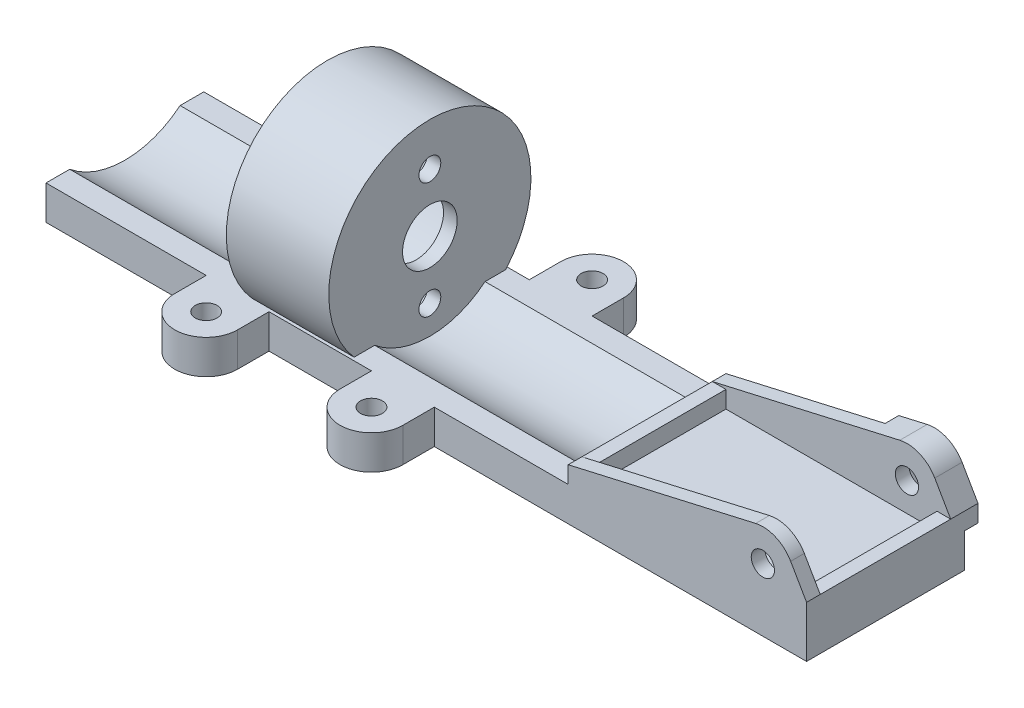
from build123d import *

# Parameters (mm, degrees)
SKETCH3_W                = 111.348371095
SKETCH3_H                = 23.1
BOSS_EXTRUDE1_DEPTH      = 5
SKETCH3_4_W              = 34.9
SKETCH3_4_H              = 23.1
BOSS_EXTRUDE2_DEPTH      = 2.5
CUT_EXTRUDE1_DEPTH       = 30.8
CUT_EXTRUDE1_DEPTH_BACK  = 67.894637304
SKETCH4_4_R              = 12.7
BOSS_EXTRUDE3_START      = -1
SKETCH4_R                = 12.7
SKETCH4_R_2              = 4
SKETCH4_R_3              = 1.6
BOSS_EXTRUDE3_DEPTH      = 2
BOSS_EXTRUDE4_DEPTH      = 2
BOSS_EXTRUDE4_DEPTH_BACK = 13
BOSS_EXTRUDE4_START      = -3
SKETCH4_3_R              = 14.8
SKETCH4_3_R_2            = 12.7
SKETCH5_R                = 4.6
SKETCH5_R_2              = 1.6
BOSS_EXTRUDE5_DEPTH      = 5
BOSS_EXTRUDE6_START      = 11.55
SKETCH6_R                = 1.7
BOSS_EXTRUDE6_DEPTH      = 2
BOSS_EXTRUDE7_START      = -11.55
BOSS_EXTRUDE7_OUTLINE_R  = 1.7
BOSS_EXTRUDE7_DEPTH      = 2
BOSS_EXTRUDE8_DEPTH      = 2
SHELL1_START             = -5
SHELL1_DEPTH             = 0.1
SHELL1_START_2           = -4.9
SHELL1_2_DEPTH           = 2.9
SHELL1_START_3           = -97.348371095
SHELL1_3_DEPTH           = 76.448371095
SHELL1_START_4           = -56.7
SHELL1_4_DEPTH           = 2
SHELL1_START_5           = -22.9
SHELL1_5_DEPTH           = 2


with BuildPart() as part:
    # Sketch3 → Boss-Extrude1 (new body)
    with BuildSketch(Plane(origin=(0, 0, 0), x_dir=(1, 0, 0), z_dir=(0, 1, 0))):
        with Locations((-43.674185548, 0)):
            Rectangle(SKETCH3_W, SKETCH3_H)
    extrude(amount=-BOSS_EXTRUDE1_DEPTH)

    # Sketch3<4> → Boss-Extrude2 (add)
    with BuildSketch(Plane(origin=(0, 0, 0), x_dir=(1, 0, 0), z_dir=(0, 1, 0))):
        with Locations((-5.45, 0)):
            Rectangle(SKETCH3_4_W, SKETCH3_4_H)
        Polygon((-20.2, 9.55), (9.3, 9.55), (10, 9.55), (10, -9.55), (9.3, -9.55), (-20.2, -9.55), (-20.9, -9.55), (-20.9, 9.55), align=None, mode=Mode.SUBTRACT)
    extrude(amount=BOSS_EXTRUDE2_DEPTH)

    # Sketch4<4> → Cut-Extrude1 (cut, two sides: drawn at the far end of the back side and taken through both)
    with BuildSketch(Plane(origin=(-53.7, 0, 0), x_dir=(0, 0, -1), z_dir=(1, 0, 0)).offset(-CUT_EXTRUDE1_DEPTH_BACK)):
        with Locations((0, 9.8)):
            Circle(SKETCH4_4_R)
    extrude(amount=CUT_EXTRUDE1_DEPTH + CUT_EXTRUDE1_DEPTH_BACK, mode=Mode.SUBTRACT)

    # Sketch4 → Boss-Extrude3 (add)
    with BuildSketch(Plane(origin=(-53.7, 0, 0), x_dir=(0, 0, -1), z_dir=(1, 0, 0)).offset(BOSS_EXTRUDE3_START)):
        with Locations((0, 9.8)):
            Circle(SKETCH4_R)
        with Locations((0, 9.8)):
            Circle(SKETCH4_R_2, mode=Mode.SUBTRACT)
        with Locations((0, 18.3)):
            Circle(SKETCH4_R_3, mode=Mode.SUBTRACT)
        with Locations((0, 1.3)):
            Circle(SKETCH4_R_3, mode=Mode.SUBTRACT)
    extrude(amount=-BOSS_EXTRUDE3_DEPTH)

    # Sketch4<3> → Boss-Extrude4 (add, two sides: drawn at the far end of the back side and taken through both)
    with BuildSketch(Plane(origin=(-53.7, 0, 0), x_dir=(0, 0, -1), z_dir=(1, 0, 0)).offset(BOSS_EXTRUDE4_START - BOSS_EXTRUDE4_DEPTH_BACK)):
        with Locations((0, 9.8)):
            Circle(SKETCH4_3_R)
        with Locations((0, 9.8)):
            Circle(SKETCH4_3_R_2, mode=Mode.SUBTRACT)
    extrude(amount=BOSS_EXTRUDE4_DEPTH + BOSS_EXTRUDE4_DEPTH_BACK)

    # Sketch5 → Boss-Extrude5 (add)
    # profile 1 of 6: a face of its own
    with BuildSketch(Plane(origin=(0, 0, 0), x_dir=(1, 0, 0), z_dir=(0, 1, 0))):
        with Locations((-47.098371095, -16.15)):
            Circle(SKETCH5_R)
        with Locations(Location((-47.098371095, -16.15, 0), (0, 0, 270))):
            Circle(SKETCH5_R_2, mode=Mode.SUBTRACT)
    # profile 2 of 6: a face of its own
    with BuildSketch(Plane(origin=(0, 0, 0), x_dir=(1, 0, 0), z_dir=(0, 1, 0))):
        with BuildLine():
            Line((-51.698371095, -11.55), (-51.698371095, -16.15))
            ThreePointArc((-51.698371095, -16.15), (-50.351062288, -12.897308807), (-47.098371095, -11.55))
            Line((-47.098371095, -11.55), (-51.698371095, -11.55))
        make_face()
    # profile 3 of 6: a face of its own
    with BuildSketch(Plane(origin=(0, 0, 0), x_dir=(1, 0, 0), z_dir=(0, 1, 0))):
        with BuildLine():
            ThreePointArc((-47.098371095, -11.55), (-43.845679901, -12.897308807), (-42.498371095, -16.15))
            Line((-42.498371095, -16.15), (-42.498371095, -11.55))
            Line((-42.498371095, -11.55), (-47.098371095, -11.55))
        make_face()
    # profile 4 of 6: a face of its own
    with BuildSketch(Plane(origin=(0, 0, 0), x_dir=(1, 0, 0), z_dir=(0, 1, 0))):
        with Locations((-71.298371095, -16.15)):
            Circle(SKETCH5_R)
        with Locations(Location((-71.298371095, -16.15, 0), (0, 0, 270))):
            Circle(SKETCH5_R_2, mode=Mode.SUBTRACT)
    # profile 5 of 6: a face of its own
    with BuildSketch(Plane(origin=(0, 0, 0), x_dir=(1, 0, 0), z_dir=(0, 1, 0))):
        with BuildLine():
            ThreePointArc((-75.898371095, -16.15), (-74.551062288, -12.897308807), (-71.298371095, -11.55))
            Line((-71.298371095, -11.55), (-75.898371095, -11.55))
            Line((-75.898371095, -11.55), (-75.898371095, -16.15))
        make_face()
    # profile 6 of 6: a face of its own
    with BuildSketch(Plane(origin=(0, 0, 0), x_dir=(1, 0, 0), z_dir=(0, 1, 0))):
        with BuildLine():
            Line((-66.698371095, -16.15), (-66.698371095, -11.55))
            Line((-66.698371095, -11.55), (-71.298371095, -11.55))
            ThreePointArc((-71.298371095, -11.55), (-68.045679901, -12.897308807), (-66.698371095, -16.15))
        make_face()
    boss_extrude5 = extrude(amount=-BOSS_EXTRUDE5_DEPTH)

    # Sketch6 → Boss-Extrude6 (add)
    with BuildSketch(Plane.XY.offset(BOSS_EXTRUDE6_START)):
        with BuildLine():
            Line((4.55162483, 8.781583733), (-22.9, 2.5))
            Line((-22.9, 2.5), (1.21821954, 2.5))
            ThreePointArc((1.21821954, 2.5), (5.6, -0.5), (9.98178046, 2.5))
            Line((9.98178046, 2.5), (12, 2.5))
            Line((12, 2.5), (9.674058028, 6.543512575))
            ThreePointArc((9.674058028, 6.543512575), (7.481735852, 8.506863149), (4.55162483, 8.781583733))
        make_face()
        with Locations(Location((5.6, 4.2, 0), (0, 0, 180))):
            Circle(SKETCH6_R, mode=Mode.SUBTRACT)
    extrude(amount=-BOSS_EXTRUDE6_DEPTH)

    # Boss-Extrude7: read off the stored shape, not the designer's step
    # Boss-Extrude7 outline → Boss-Extrude7 (add)
    with BuildSketch(Plane.XY.offset(BOSS_EXTRUDE7_START)):
        with BuildLine():
            Line((4.55162483, 8.781583733), (-22.9, 2.5))
            Line((-22.9, 2.5), (-20.9, 2.5))
            Line((-20.9, 2.5), (-20.9, 0))
            Line((-20.9, 0), (10, 0))
            Line((10, 0), (10, 2.5))
            Line((10, 2.5), (12, 2.5))
            Line((12, 2.5), (9.674058028, 6.543512575))
            ThreePointArc((9.674058028, 6.543512575), (7.481735852, 8.506863149), (4.55162483, 8.781583733))
        make_face()
        with Locations((5.6, 4.2)):
            Circle(BOSS_EXTRUDE7_OUTLINE_R, mode=Mode.SUBTRACT)
    extrude(amount=BOSS_EXTRUDE7_DEPTH)

    # Mirror1: Boss-Extrude5 across plane
    add(boss_extrude5.mirror(Plane.XY))

    # Sketch7 → Boss-Extrude8 (add)
    with BuildSketch(Plane(origin=(0, 0, -11.55), x_dir=(-1, 0, 0), z_dir=(0, 0, -1))):
        with BuildLine():
            Line((-12, 0), (-0.4, 0))
            Line((-0.4, 0), (-0.4, 7.831593371))
            Line((-0.4, 7.831593371), (-4.55162483, 8.781583733))
            ThreePointArc((-4.55162483, 8.781583733), (-7.481735852, 8.506863149), (-9.674058028, 6.543512575))
            Line((-9.674058028, 6.543512575), (-12, 2.5))
            Line((-12, 2.5), (-12, 0))
        make_face()
        Polygon((-7.2, 6.971281292), (-4, 6.971281292), (-2.4, 4.2), (-4, 1.428718708), (-7.2, 1.428718708), (-8.8, 4.2), align=None, mode=Mode.SUBTRACT)
    extrude(amount=BOSS_EXTRUDE8_DEPTH)

    # Shell1: read off the stored shape, not the designer's step
    # Shell1 outline → Shell1 (cut)
    with BuildSketch(Plane(origin=(0, 0, 0), x_dir=(1, 0, 0), z_dir=(0, 1, 0)).offset(SHELL1_START)):
        with BuildLine():
            Line((10, -9.55), (10, 9.55))
            Line((10, 9.55), (-44.498371095, 9.55))
            Line((-44.498371095, 9.55), (-44.498371095, 13.66002008))
            ThreePointArc((-44.498371095, 13.66002008), (-47.098371095, 12.55), (-49.698371095, 13.66002008))
            Line((-49.698371095, 13.66002008), (-49.698371095, 9.55))
            Line((-49.698371095, 9.55), (-68.698371095, 9.55))
            Line((-68.698371095, 9.55), (-68.698371095, 13.66002008))
            ThreePointArc((-68.698371095, 13.66002008), (-71.298371095, 12.55), (-73.898371095, 13.66002008))
            Line((-73.898371095, 13.66002008), (-73.898371095, 9.55))
            Line((-73.898371095, 9.55), (-97.348371095, 9.55))
            Line((-97.348371095, 9.55), (-97.348371095, -9.55))
            Line((-97.348371095, -9.55), (-73.898371095, -9.55))
            Line((-73.898371095, -9.55), (-73.898371095, -13.66002008))
            ThreePointArc((-73.898371095, -13.66002008), (-71.298371095, -12.55), (-68.698371095, -13.66002008))
            Line((-68.698371095, -13.66002008), (-68.698371095, -9.55))
            Line((-68.698371095, -9.55), (-49.698371095, -9.55))
            Line((-49.698371095, -9.55), (-49.698371095, -13.66002008))
            ThreePointArc((-49.698371095, -13.66002008), (-47.098371095, -12.55), (-44.498371095, -13.66002008))
            Line((-44.498371095, -13.66002008), (-44.498371095, -9.55))
            Line((-44.498371095, -9.55), (10, -9.55))
        make_face()
    extrude(amount=SHELL1_DEPTH, mode=Mode.SUBTRACT)

    # Shell1 2 outline → Shell1 2 (cut)
    with BuildSketch(Plane(origin=(0, 0, 0), x_dir=(1, 0, 0), z_dir=(0, 1, 0)).offset(SHELL1_START_2)):
        with BuildLine():
            Line((10, -9.55), (10, 9.55))
            Line((10, 9.55), (-44.498371095, 9.55))
            Line((-44.498371095, 9.55), (-44.498371095, 13.66002008))
            ThreePointArc((-44.498371095, 13.66002008), (-47.098371095, 12.55), (-49.698371095, 13.66002008))
            Line((-49.698371095, 13.66002008), (-49.698371095, 9.55))
            Line((-49.698371095, 9.55), (-68.698371095, 9.55))
            Line((-68.698371095, 9.55), (-68.698371095, 13.66002008))
            ThreePointArc((-68.698371095, 13.66002008), (-71.298371095, 12.55), (-73.898371095, 13.66002008))
            Line((-73.898371095, 13.66002008), (-73.898371095, 9.55))
            Line((-73.898371095, 9.55), (-97.348371095, 9.55))
            Line((-97.348371095, 9.55), (-97.348371095, -9.55))
            Line((-97.348371095, -9.55), (-73.898371095, -9.55))
            Line((-73.898371095, -9.55), (-73.898371095, -13.66002008))
            ThreePointArc((-73.898371095, -13.66002008), (-71.298371095, -12.55), (-68.698371095, -13.66002008))
            Line((-68.698371095, -13.66002008), (-68.698371095, -9.55))
            Line((-68.698371095, -9.55), (-49.698371095, -9.55))
            Line((-49.698371095, -9.55), (-49.698371095, -13.66002008))
            ThreePointArc((-49.698371095, -13.66002008), (-47.098371095, -12.55), (-44.498371095, -13.66002008))
            Line((-44.498371095, -13.66002008), (-44.498371095, -9.55))
            Line((-44.498371095, -9.55), (10, -9.55))
        make_face()
    extrude(amount=SHELL1_2_DEPTH, mode=Mode.SUBTRACT)

    # Shell1 3 outline → Shell1 3 (add)
    with BuildSketch(Plane.YZ.offset(SHELL1_START_3)):
        with BuildLine():
            ThreePointArc((-2, -4.695742753), (-2.9, 0), (-2, 4.695742753))
            Line((-2, 4.695742753), (-2, 8.766413178))
            ThreePointArc((-2, 8.766413178), (-4.9, 0), (-2, -8.766413178))
            Line((-2, -8.766413178), (-2, -4.695742753))
        make_face()
    extrude(amount=SHELL1_3_DEPTH)

    # Shell1 4 outline → Shell1 4 (add)
    with BuildSketch(Plane.YZ.offset(SHELL1_START_4)):
        with BuildLine():
            Line((-2, -4.695742753), (-2, 4.695742753))
            ThreePointArc((-2, 4.695742753), (-2.9, 0), (-2, -4.695742753))
        make_face()
    extrude(amount=SHELL1_4_DEPTH)

    # Shell1 5 outline → Shell1 5 (add)
    with BuildSketch(Plane.YZ.offset(SHELL1_START_5)):
        with BuildLine():
            Line((-2, -4.695742753), (-2, 4.695742753))
            ThreePointArc((-2, 4.695742753), (-2.9, 0), (-2, -4.695742753))
        make_face()
    extrude(amount=SHELL1_5_DEPTH)


solid = part.part
